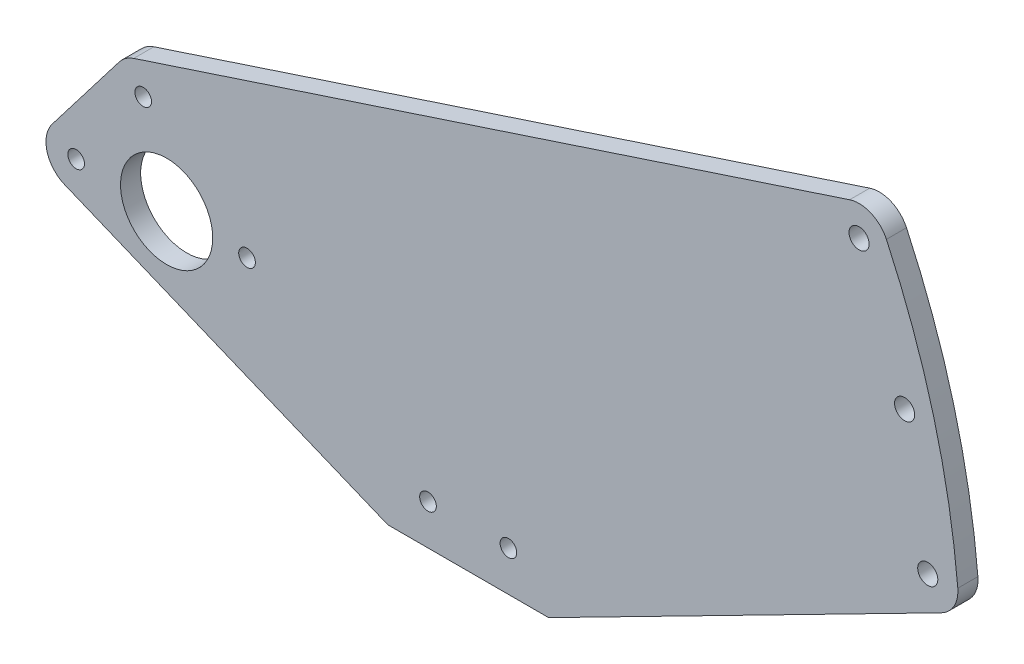
from build123d import *

# Parameters (mm, degrees)
SKETCH1_R           = 14.5542
SKETCH1_R_2         = 2.6289
SKETCH1_R_3         = 3.175
BOSS_EXTRUDE1_DEPTH = 6.35


with BuildPart() as part:
    # Sketch1 → Boss-Extrude1 (new body)
    with BuildSketch(Plane.XY):
        with BuildLine():
            Line((-36.131690566, 5.798452611), (-14.95244478, 33.399783098))
            ThreePointArc((-14.95244478, 33.399783098), (-12.907289703, 35.369766722), (-10.372281426, 36.649308755))
            Line((-10.372281426, 36.649308755), (215.715541799, 111.025764827))
            ThreePointArc((215.715541799, 111.025764827), (222.474160144, 110.71972065), (227.324650683, 106.003225501))
            ThreePointArc((227.324650683, 106.003225501), (242.278345379, 64.918286988), (249.870535149, 21.860839175))
            ThreePointArc((249.870535149, 21.860839175), (248.714513601, 16.416443349), (244.713320148, 12.547556856))
            Line((244.713320148, 12.547556856), (120.65, -50.8))
            Line((120.65, -50.8), (69.85, -50.8))
            Line((69.85, -50.8), (-32.199514598, -8.808434533))
            ThreePointArc((-32.199514598, -8.808434533), (-37.772560831, -2.475984603), (-36.131690566, 5.798452611))
        make_face()
        Circle(SKETCH1_R, mode=Mode.SUBTRACT)
        with Locations((-28.575, 0)):
            Circle(SKETCH1_R_2, mode=Mode.SUBTRACT)
        with Locations((-7.395754214, 27.601330486)):
            Circle(SKETCH1_R_2, mode=Mode.SUBTRACT)
        with Locations((240.38178065, 21.030680725)):
            Circle(SKETCH1_R_3, mode=Mode.SUBTRACT)
        with Locations((233.077901884, 62.453035583)):
            Circle(SKETCH1_R_3, mode=Mode.SUBTRACT)
        with Locations((218.692069012, 101.977786558)):
            Circle(SKETCH1_R_3, mode=Mode.SUBTRACT)
        with Locations((82.55, -38.1)):
            Circle(SKETCH1_R_2, mode=Mode.SUBTRACT)
        with Locations((107.95, -38.1)):
            Circle(SKETCH1_R_2, mode=Mode.SUBTRACT)
        with Locations((25.4, 0)):
            Circle(SKETCH1_R_2, mode=Mode.SUBTRACT)
    extrude(amount=BOSS_EXTRUDE1_DEPTH)


solid = part.part
